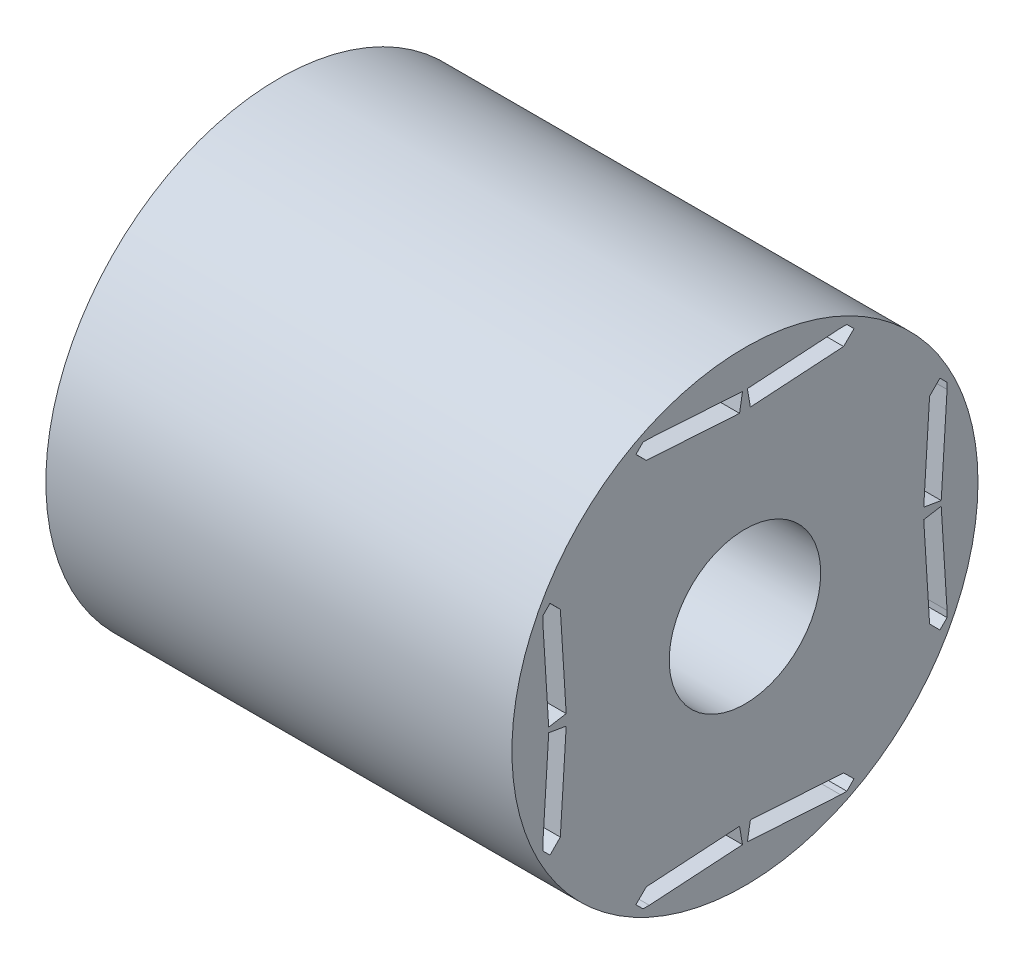
from build123d import *

# Parameters (mm, degrees)
SKETCH1_R           = 100
BOSS_EXTRUDE1_DEPTH = 10
SKETCH2_R           = 32.5
CUT_EXTRUDE1_DEPTH  = 250
LPATTERN5_COUNT     = 20
LPATTERN5_PITCH     = 10


with BuildPart() as part:
    # Sketch1 → Boss-Extrude1 (new body)
    with BuildSketch(Plane(origin=(0, 0, 0), x_dir=(0, 0, -1), z_dir=(1, 0, 0))):
        Circle(SKETCH1_R)
    boss_extrude1 = extrude(amount=BOSS_EXTRUDE1_DEPTH)

    # Sketch2 → Cut-Extrude1 (cut)
    with BuildSketch(Plane(origin=(10, 0, 0), x_dir=(0, 0, -1), z_dir=(1, 0, 0))):
        Circle(SKETCH2_R)
        Polygon((1.047809143, 84.212465352), (2.321864858, 76.712465352), (42.321864858, 79.227207296), (46.796605305, 83.651032908), (43.720430917, 86.727207296), (41.047809143, 86.727207296), align=None)
        Polygon((-1.047809143, 84.212465352), (-2.321864858, 76.712465352), (-42.321864858, 79.227207296), (-46.796605305, 83.651032908), (-43.720430917, 86.727207296), (-41.047809143, 86.727207296), align=None)
        Polygon((84.212465352, 1.047809143), (76.712465352, 2.321864858), (79.227207296, 42.321864858), (83.651032908, 46.796605305), (86.727207296, 43.720430917), (86.727207296, 41.047809143), align=None)
        Polygon((84.212465352, -1.047809143), (86.727207296, -41.047809143), (86.727207296, -43.720430917), (83.651032908, -46.796605305), (79.227207296, -42.321864858), (76.712465352, -2.321864858), align=None)
        Polygon((1.047809143, -84.212465352), (2.321864858, -76.712465352), (42.321864858, -79.227207296), (46.796605305, -83.651032908), (43.720430917, -86.727207296), (41.047809143, -86.727207296), align=None)
        Polygon((-1.047809143, -84.212465352), (-41.047809143, -86.727207296), (-43.720430917, -86.727207296), (-46.796605305, -83.651032908), (-42.321864858, -79.227207296), (-2.321864858, -76.712465352), align=None)
        Polygon((-84.212465352, -1.047809143), (-76.712465352, -2.321864858), (-79.227207296, -42.321864858), (-83.651032908, -46.796605305), (-86.727207296, -43.720430917), (-86.727207296, -41.047809143), align=None)
        Polygon((-84.212465352, 1.047809143), (-86.727207296, 41.047809143), (-86.727207296, 43.720430917), (-83.651032908, 46.796605305), (-79.227207296, 42.321864858), (-76.712465352, 2.321864858), align=None)
    cut_extrude1 = extrude(amount=-CUT_EXTRUDE1_DEPTH, mode=Mode.SUBTRACT)

    # LPattern5: Boss-Extrude1, Cut-Extrude1 ×20
    with Locations(*[(-i * LPATTERN5_PITCH, 0, 0) for i in range(1, LPATTERN5_COUNT)]):
        add(boss_extrude1)
        add(cut_extrude1, mode=Mode.SUBTRACT)


solid = part.part
